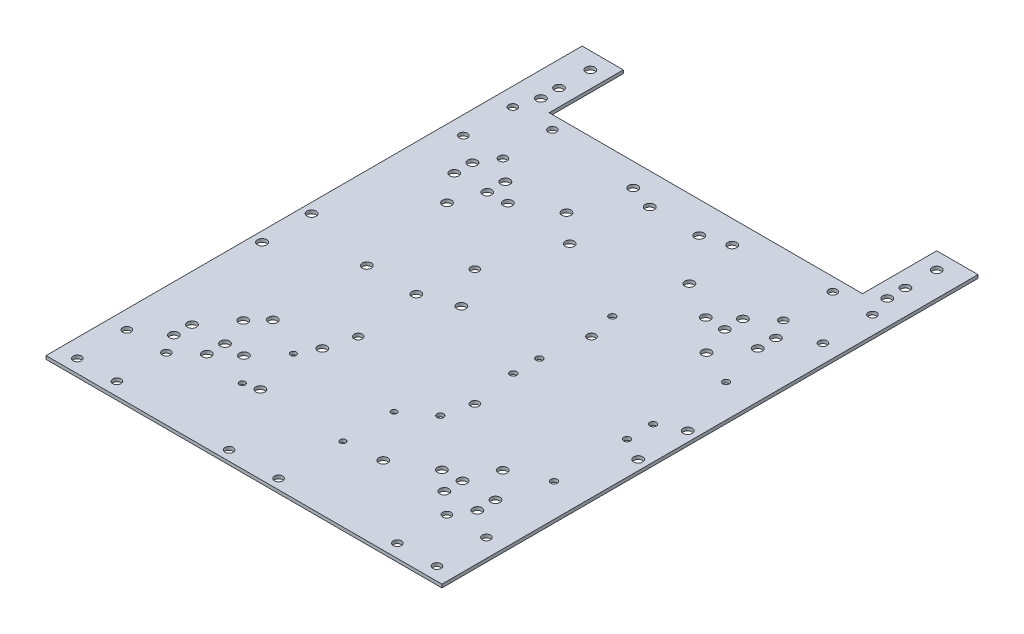
from build123d import *

# Parameters (mm, degrees)
SM_BASE_FLANGE_2_DEPTH   = 2
SKETCH_26_R              = 2.5
CUT_EXTRUDE_1_DEPTH      = 221.519840377
SKETCH_27_R              = 2.5
CUT_EXTRUDE_2_DEPTH      = 10
SKETCH_28_R              = 2.75
CUT_EXTRUDE_3_DEPTH      = 10
SKETCH_29_R              = 2.75
CUT_EXTRUDE_4_DEPTH      = 10
SKETCH_30_R              = 2.75
CUT_EXTRUDE_5_DEPTH      = 10
MIRROR_3_COPY_1_SKETCH_R = 2.75
MIRROR_3_COPY_1_DEPTH    = 10
SKETCH_31_R              = 2
CUT_EXTRUDE_6_DEPTH      = 10
PATTERN_LINEAR_1_COUNT   = 2
PATTERN_LINEAR_1_PITCH   = 60
SKETCH_32_R              = 2.75
CUT_EXTRUDE_7_DEPTH      = 10
SKETCH_33_R              = 2.75
CUT_EXTRUDE_8_DEPTH      = 10
SKETCH_34_R              = 1.75
CUT_EXTRUDE_9_DEPTH      = 10
SKETCH_35_R              = 2.75
CUT_EXTRUDE_10_DEPTH     = 10
SKETCH_36_R              = 2.75
SKETCH_36_R_2            = 2.5
CUT_EXTRUDE_11_DEPTH     = 10


# Sheet-metal steps are written as plain solids
with BuildPart() as part:
    # 草图2 → 基体-法兰2 (new body)
    with BuildSketch(Plane(origin=(0, 0, 0), x_dir=(1, 0, 0), z_dir=(0, 1, 0))):
        Polygon((-120, 140), (-120, 185), (-95, 185), (-95, 140), (95, 140), (95, 185), (120, 185), (120, 140), (120, -140), (-120, -140), align=None)
    extrude(amount=-SM_BASE_FLANGE_2_DEPTH)

    # 草图26 → 切除-拉伸1 (cut, through all)
    with BuildSketch(Plane(origin=(0, 0, 0), x_dir=(1, 0, 0), z_dir=(0, 1, 0))):
        with Locations(Location((-109, 102, 0), (0, 0, 270))):
            Circle(SKETCH_26_R)
        with Locations(Location((-109, 132, 0), (0, 0, 270))):
            Circle(SKETCH_26_R)
        with Locations(Location((-85, 132, 0), (0, 0, 270))):
            Circle(SKETCH_26_R)
        with Locations(Location((-85, 102, 0), (0, 0, 270))):
            Circle(SKETCH_26_R)
        with Locations(Location((-85, -102, 0), (0, 0, 90))):
            Circle(SKETCH_26_R)
        with Locations(Location((-85, -132, 0), (0, 0, 90))):
            Circle(SKETCH_26_R)
        with Locations(Location((-109, -132, 0), (0, 0, 90))):
            Circle(SKETCH_26_R)
        with Locations(Location((-109, -102, 0), (0, 0, 90))):
            Circle(SKETCH_26_R)
        with Locations(Location((85, 102, 0), (0, 0, 90))):
            Circle(SKETCH_26_R)
        with Locations(Location((85, 132, 0), (0, 0, 90))):
            Circle(SKETCH_26_R)
        with Locations(Location((109, 132, 0), (0, 0, 90))):
            Circle(SKETCH_26_R)
        with Locations(Location((109, 102, 0), (0, 0, 90))):
            Circle(SKETCH_26_R)
        with Locations(Location((109, -102, 0), (0, 0, 270))):
            Circle(SKETCH_26_R)
        with Locations(Location((109, -132, 0), (0, 0, 270))):
            Circle(SKETCH_26_R)
        with Locations(Location((85, -132, 0), (0, 0, 270))):
            Circle(SKETCH_26_R)
        with Locations(Location((85, -102, 0), (0, 0, 270))):
            Circle(SKETCH_26_R)
    extrude(amount=-CUT_EXTRUDE_1_DEPTH, mode=Mode.SUBTRACT)

    # 草图27 → 切除-拉伸2 (cut)
    with BuildSketch(Plane.XZ.offset(2)):
        with Locations(Location((-35.355339059, 35.355339059, 0), (0, 0, 270))):
            Circle(SKETCH_27_R)
        with Locations(Location((35.355339059, 35.355339059, 0), (0, 0, 270))):
            Circle(SKETCH_27_R)
        with Locations(Location((35.355339059, -35.355339059, 0), (0, 0, 270))):
            Circle(SKETCH_27_R)
        with Locations(Location((-35.355339059, -35.355339059, 0), (0, 0, 270))):
            Circle(SKETCH_27_R)
    extrude(amount=-CUT_EXTRUDE_2_DEPTH, mode=Mode.SUBTRACT)

    # 草图28 → 切除-拉伸3 (cut)
    with BuildSketch(Plane.XZ.offset(2)):
        with Locations(Location((-60, -80, 0), (0, 0, 270))):
            Circle(SKETCH_28_R)
        with Locations(Location((-37.250025969, -92.803208809, 0), (0, 0, 270))):
            Circle(SKETCH_28_R)
        with Locations(Location((-78.661073186, -61.744923397, 0), (0, 0, 270))):
            Circle(SKETCH_28_R)
        with Locations(Location((78.661073186, -61.744923397, 0), (0, 0, 90))):
            Circle(SKETCH_28_R)
        with Locations(Location((37.250025969, -92.803208809, 0), (0, 0, 90))):
            Circle(SKETCH_28_R)
        with Locations(Location((60, -80, 0), (0, 0, 90))):
            Circle(SKETCH_28_R)
        with Locations(Location((-78.661073186, 61.744923397, 0), (0, 0, 90))):
            Circle(SKETCH_28_R)
        with Locations(Location((-37.250025969, 92.803208809, 0), (0, 0, 90))):
            Circle(SKETCH_28_R)
        with Locations(Location((-60, 80, 0), (0, 0, 90))):
            Circle(SKETCH_28_R)
        with Locations(Location((60, 80, 0), (0, 0, 270))):
            Circle(SKETCH_28_R)
        with Locations(Location((37.250025969, 92.803208809, 0), (0, 0, 270))):
            Circle(SKETCH_28_R)
        with Locations(Location((78.661073186, 61.744923397, 0), (0, 0, 270))):
            Circle(SKETCH_28_R)
    extrude(amount=-CUT_EXTRUDE_3_DEPTH, mode=Mode.SUBTRACT)

    # 草图29 → 切除-拉伸4 (cut)
    with BuildSketch(Plane.XZ.offset(2)):
        with Locations(Location((105, -175, 0), (0, 0, 270))):
            Circle(SKETCH_29_R)
        with Locations(Location((105, -156, 0), (0, 0, 270))):
            Circle(SKETCH_29_R)
        with Locations(Location((105, -145, 0), (0, 0, 270))):
            Circle(SKETCH_29_R)
    cut_extrude_4 = extrude(amount=-CUT_EXTRUDE_4_DEPTH, mode=Mode.SUBTRACT)

    # 镜向1: 切除-拉伸4 across plane
    add(cut_extrude_4.mirror(Plane(origin=(0, 0, 0), x_dir=(0, 0, 1), z_dir=(1, 0, 0))), mode=Mode.SUBTRACT)

    # 草图30 → 切除-拉伸5 (cut)
    with BuildSketch(Plane(origin=(0, 0, 0), x_dir=(1, 0, 0), z_dir=(0, 1, 0))):
        with Locations(Location((-92, 90.5, 0), (0, 0, 270))):
            Circle(SKETCH_30_R)
        with Locations(Location((-92, 79.5, 0), (0, 0, 270))):
            Circle(SKETCH_30_R)
        with Locations(Location((-72, 79.5, 0), (0, 0, 270))):
            Circle(SKETCH_30_R)
        with Locations(Location((-72, 90.5, 0), (0, 0, 270))):
            Circle(SKETCH_30_R)
    cut_extrude_5 = extrude(amount=-CUT_EXTRUDE_5_DEPTH, mode=Mode.SUBTRACT)

    # 镜向2: 切除-拉伸5 across plane
    add(cut_extrude_5.mirror(Plane.XY), mode=Mode.SUBTRACT)

    # 镜向3: 切除-拉伸5 across plane
    add(cut_extrude_5.mirror(Plane(origin=(0, 0, 0), x_dir=(0, 0, 1), z_dir=(1, 0, 0))), mode=Mode.SUBTRACT)

    # 镜向3 copy 1 sketch → 镜向3 copy 1 (cut)
    with BuildSketch(Plane(origin=(0, 0, 0), x_dir=(-1, 0, 0), z_dir=(0, 1, 0))):
        with Locations(Location((-92, 90.5, 0), (0, 0, 270))):
            Circle(MIRROR_3_COPY_1_SKETCH_R)
        with Locations(Location((-92, 79.5, 0), (0, 0, 270))):
            Circle(MIRROR_3_COPY_1_SKETCH_R)
        with Locations(Location((-72, 79.5, 0), (0, 0, 270))):
            Circle(MIRROR_3_COPY_1_SKETCH_R)
        with Locations(Location((-72, 90.5, 0), (0, 0, 270))):
            Circle(MIRROR_3_COPY_1_SKETCH_R)
    extrude(amount=-MIRROR_3_COPY_1_DEPTH, mode=Mode.SUBTRACT)

    # 草图31 → 切除-拉伸6 (cut)
    with BuildSketch(Plane(origin=(0, 0, 0), x_dir=(1, 0, 0), z_dir=(0, 1, 0))):
        with Locations(Location((31.05, -52, 0), (0, 0, 270))):
            Circle(SKETCH_31_R)
        with Locations(Location((31.05, -7.74, 0), (0, 0, 270))):
            Circle(SKETCH_31_R)
        with Locations(Location((100, -7.74, 0), (0, 0, 270))):
            Circle(SKETCH_31_R)
        with Locations(Location((100, -52, 0), (0, 0, 270))):
            Circle(SKETCH_31_R)
    cut_extrude_6 = extrude(amount=-CUT_EXTRUDE_6_DEPTH, mode=Mode.SUBTRACT)

    # 阵列(线性)1: 切除-拉伸6 ×2
    with Locations(*[(0, 0, -i * PATTERN_LINEAR_1_PITCH) for i in range(1, PATTERN_LINEAR_1_COUNT)]):
        add(cut_extrude_6, mode=Mode.SUBTRACT)

    # 草图32 → 切除-拉伸7 (cut)
    with BuildSketch(Plane(origin=(0, 0, 0), x_dir=(1, 0, 0), z_dir=(0, 1, 0))):
        with Locations(Location((-20, 77.5, 0), (0, 0, 270))):
            Circle(SKETCH_32_R)
        with Locations(Location((-20, 11.8, 0), (0, 0, 270))):
            Circle(SKETCH_32_R)
    extrude(amount=-CUT_EXTRUDE_7_DEPTH, mode=Mode.SUBTRACT)

    # 草图33 → 切除-拉伸8 (cut)
    with BuildSketch(Plane(origin=(0, 0, 0), x_dir=(1, 0, 0), z_dir=(0, 1, 0))):
        with Locations(Location((-70, -52.5, 0), (0, 0, 270))):
            Circle(SKETCH_33_R)
        with Locations(Location((-70, 4.5, 0), (0, 0, 270))):
            Circle(SKETCH_33_R)
        with Locations(Location((-40, 4.5, 0), (0, 0, 270))):
            Circle(SKETCH_33_R)
        with Locations(Location((-40, -52.5, 0), (0, 0, 270))):
            Circle(SKETCH_33_R)
    extrude(amount=-CUT_EXTRUDE_8_DEPTH, mode=Mode.SUBTRACT)

    # 草图34 → 切除-拉伸9 (cut)
    with BuildSketch(Plane(origin=(0, 0, 0), x_dir=(1, 0, 0), z_dir=(0, 1, 0))):
        with Locations(Location((15, -95, 0), (0, 0, 270))):
            Circle(SKETCH_34_R)
        with Locations(Location((15, -64, 0), (0, 0, 270))):
            Circle(SKETCH_34_R)
        with Locations(Location((-46, -64, 0), (0, 0, 270))):
            Circle(SKETCH_34_R)
        with Locations(Location((-46, -95, 0), (0, 0, 270))):
            Circle(SKETCH_34_R)
    extrude(amount=-CUT_EXTRUDE_9_DEPTH, mode=Mode.SUBTRACT)

    # 草图35 → 切除-拉伸10 (cut)
    with BuildSketch(Plane.XZ.offset(2)):
        with Locations(Location((30, -126, 0), (0, 0, 270))):
            Circle(SKETCH_35_R)
        with Locations(Location((-30, -126, 0), (0, 0, 90))):
            Circle(SKETCH_35_R)
    extrude(amount=-CUT_EXTRUDE_10_DEPTH, mode=Mode.SUBTRACT)

    # 草图36 → 切除-拉伸11 (cut)
    with BuildSketch(Plane.XZ.offset(2)):
        with Locations(Location((-114, -15, 0), (0, 0, 270))):
            Circle(SKETCH_36_R)
        with Locations(Location((-114, 15, 0), (0, 0, 90))):
            Circle(SKETCH_36_R)
        with Locations(Location((114, -15, 0), (0, 0, 90))):
            Circle(SKETCH_36_R)
        with Locations(Location((114, 15, 0), (0, 0, 270))):
            Circle(SKETCH_36_R)
        with Locations(Location((15, 134, 0), (0, 0, 90))):
            Circle(SKETCH_36_R_2)
        with Locations(Location((-15, 134, 0), (0, 0, 270))):
            Circle(SKETCH_36_R_2)
        with Locations(Location((15, -121, 0), (0, 0, 270))):
            Circle(SKETCH_36_R)
        with Locations(Location((-15, -121, 0), (0, 0, 90))):
            Circle(SKETCH_36_R)
    extrude(amount=-CUT_EXTRUDE_11_DEPTH, mode=Mode.SUBTRACT)


solid = part.part
